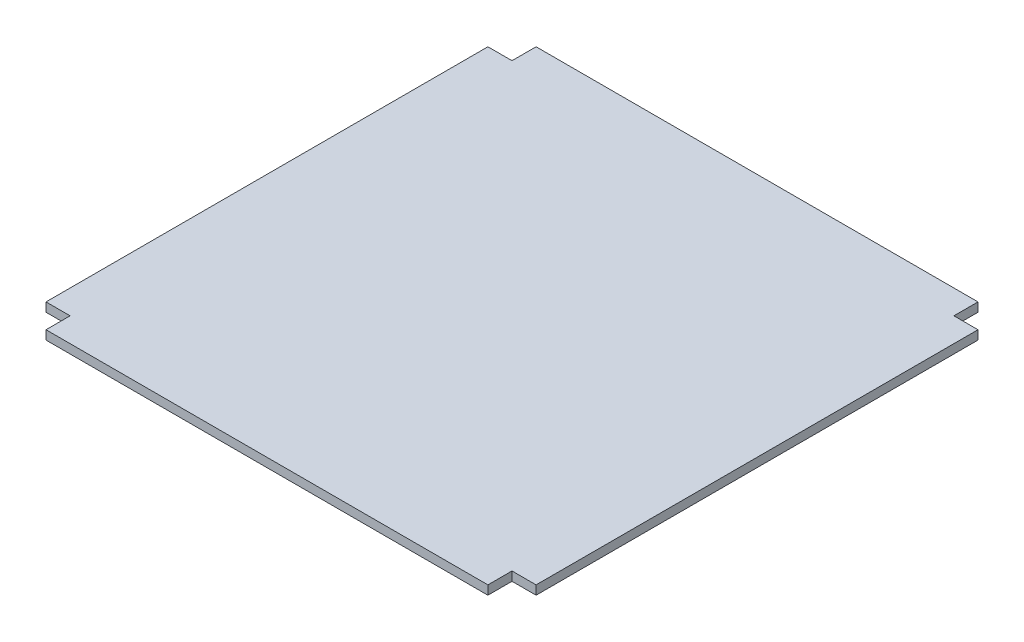
from build123d import *

# Parameters (mm, degrees)
BOSS_EXTRUDE1_DEPTH = 5.588


with BuildPart() as part:
    # Sketch2 → Boss-Extrude1 (new body)
    with BuildSketch(Plane(origin=(0, 0, 0), x_dir=(1, 0, 0), z_dir=(0, 1, 0))):
        Polygon((0, 289.814), (0, 14.986), (14.986, 14.986), (14.986, 0), (289.814, 0), (289.814, 14.986), (304.8, 14.986), (304.8, 289.814), (289.814, 289.814), (289.814, 304.8), (14.986, 304.8), (14.986, 289.814), align=None)
    extrude(amount=BOSS_EXTRUDE1_DEPTH)


solid = part.part
